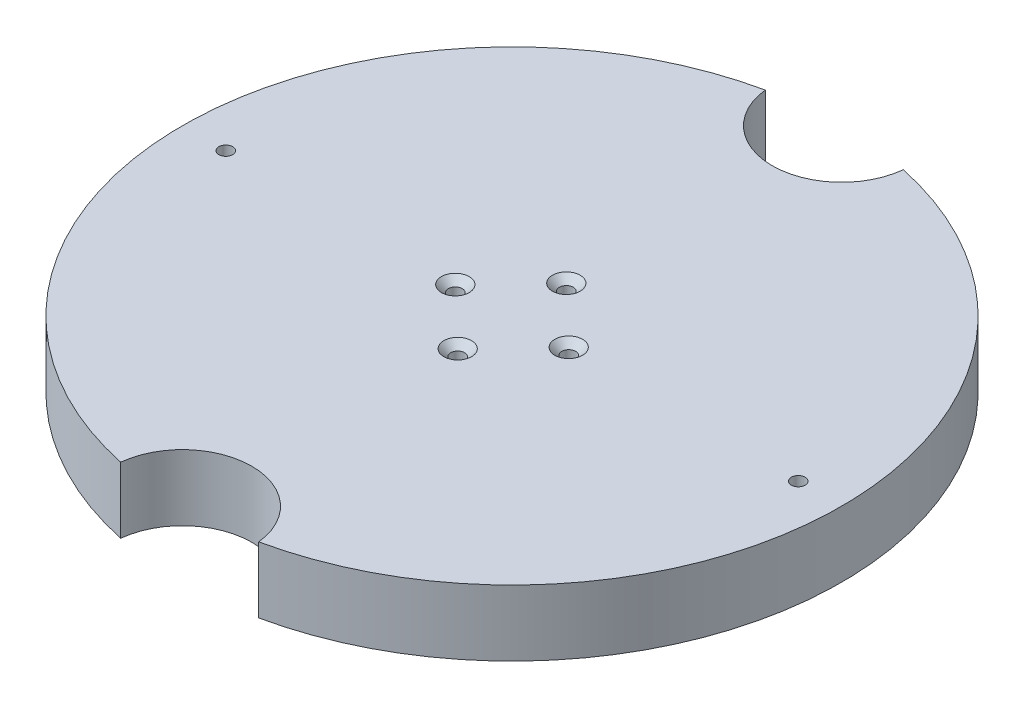
from build123d import *

# Parameters (mm, degrees)
SKETCH1_R                = 47.5
BOSS_EXTRUDE1_DEPTH      = 9.5
CUT_EXTRUDE1_DEPTH       = 9.5
CAVITY1_OUTLINE_R        = 1
CAVITY1_DEPTH            = 9.5
CHAMFER1_SIZE            = 1
SKETCH3_R                = 1
CUT_EXTRUDE2_DEPTH       = 9.5
CHAMFER2_SIZE            = 1
CHAMFER2_OF_MIRROR2_SIZE = 1


# Read off the part's stored shape, not the designer's step: Cavity1
with BuildPart() as part:
    # Sketch1 → Boss-Extrude1 (new body)
    with BuildSketch(Plane(origin=(0, 0, 0), x_dir=(1, 0, 0), z_dir=(0, 1, 0))):
        with Locations(Location((0, 0, 0), (0, 0, 270))):
            Circle(SKETCH1_R)
    extrude(amount=BOSS_EXTRUDE1_DEPTH)

    # Sketch2 → Cut-Extrude1 (cut)
    with BuildSketch(Plane(origin=(0, 9.5, 0), x_dir=(1, 0, 0), z_dir=(0, 1, 0))):
        with BuildLine():
            Line((-10, 47.5), (10, 47.5))
            ThreePointArc((10, 47.5), (0, 37.5), (-10, 47.5))
        make_face()
    cut_extrude1 = extrude(amount=-CUT_EXTRUDE1_DEPTH, mode=Mode.SUBTRACT)

    # Mirror1: Cut-Extrude1 across plane
    add(cut_extrude1.mirror(Plane.XY), mode=Mode.SUBTRACT)

    # Cavity1 outline → Cavity1 (cut)
    with BuildSketch(Plane(origin=(0, 0, 0), x_dir=(1, 0, 0), z_dir=(0, 1, 0))):
        with Locations((7.9981372, 0.17263061)):
            Circle(CAVITY1_OUTLINE_R)
        with Locations((0.17263061, -7.9981372)):
            Circle(CAVITY1_OUTLINE_R)
        with Locations((-0.17263061, 7.9981372)):
            Circle(CAVITY1_OUTLINE_R)
        with Locations((-7.9981372, -0.17263061)):
            Circle(CAVITY1_OUTLINE_R)
    extrude(amount=CAVITY1_DEPTH, mode=Mode.SUBTRACT)

    # Chamfer1
    chamfer1_edges = [part.edges().sort_by_distance(p)[0] for p in [
        (-8.9981372, 9.5, 0.17263061),
        (-1.17263061, 9.5, -7.9981372),
        (-0.82736939, 9.5, 7.9981372),
        (6.9981372, 9.5, -0.17263061),
    ]]
    chamfer(chamfer1_edges, length=CHAMFER1_SIZE)

    # Sketch3 → Cut-Extrude2 (cut)
    with BuildSketch(Plane(origin=(0, 9.5, 0), x_dir=(1, 0, 0), z_dir=(0, 1, 0))):
        with Locations(Location((-41.25, 0, 0), (0, 0, 270))):
            Circle(SKETCH3_R)
    cut_extrude2 = extrude(amount=-CUT_EXTRUDE2_DEPTH, mode=Mode.SUBTRACT)

    # Chamfer2
    chamfer2_edges = [part.edges().sort_by_distance(p)[0] for p in [
        (-41.25, 0, -1),
    ]]
    chamfer(chamfer2_edges, length=CHAMFER2_SIZE)

    # Mirror2: Cut-Extrude2 across plane
    add(cut_extrude2.mirror(Plane(origin=(0, 0, 0), x_dir=(0, 0, 1), z_dir=(1, 0, 0))), mode=Mode.SUBTRACT)

    # Chamfer2 of Mirror2
    chamfer2_of_mirror2_edges = [part.edges().sort_by_distance(p)[0] for p in [
        (41.25, 0, -1),
    ]]
    chamfer(chamfer2_of_mirror2_edges, length=CHAMFER2_OF_MIRROR2_SIZE)


solid = part.part
